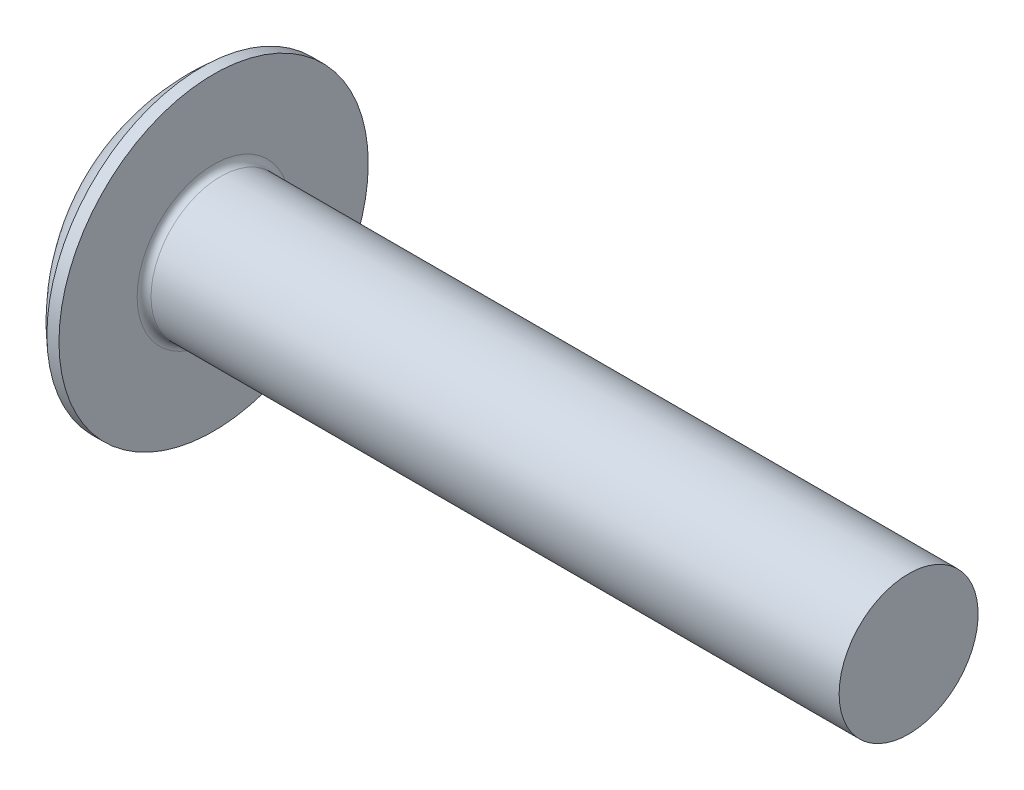
from build123d import *

# Parameters (mm, degrees)
FILLET1_R  = 0.4
SLOTSKE_W  = 17.8
SLOTSKE_H  = 1.6
SLOT_DEPTH = 2.4


with BuildPart() as part:
    # BodySke → BaseBody (revolve)
    with BuildSketch(Plane.XY):
        with BuildLine():
            Line((4.8, 8.9), (4.8, 4))
            Line((4.8, 4), (44.8, 4))
            Line((44.8, 4), (44.8, 0))
            Line((44.8, 0), (0, 0))
            ThreePointArc((0, 0), (1.075772976, 4.900591816), (4.105264982, 8.9))
            Line((4.105264982, 8.9), (4.8, 8.9))
        make_face()
    revolve(axis=Axis((0, 0, 0), (1, 0, 0)))

    # Fillet1
    fillet1_edges = [part.edges().sort_by_distance(p)[0] for p in [
        (4.8, -4, 0),
    ]]
    fillet(fillet1_edges, radius=FILLET1_R)

    # SlotSke → Slot (cut)
    with BuildSketch(Plane(origin=(0, 0, 0), x_dir=(0, 0, -1), z_dir=(1, 0, 0))):
        Rectangle(SLOTSKE_W, SLOTSKE_H)
    extrude(amount=SLOT_DEPTH, mode=Mode.SUBTRACT)


solid = part.part
